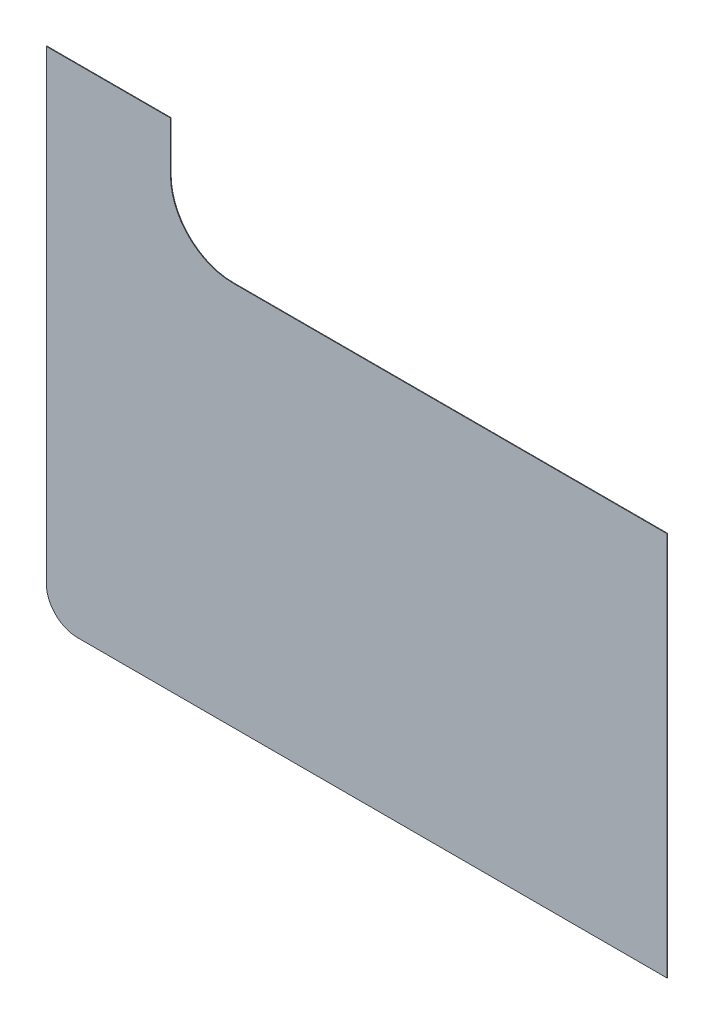
from build123d import *

# Parameters (mm, degrees)
EXTRUDE_1_DEPTH = 0.1
FILLET_1_R      = 10
FILLET_2_R      = 5


with BuildPart() as part:
    # 草图1 → 凸台-拉伸1 (new body)
    with BuildSketch(Plane.XY):
        Polygon((0, 0), (-100, 0), (-100, 80), (-80, 80), (-80, 62), (0, 62), align=None)
    extrude(amount=EXTRUDE_1_DEPTH)

    # 圆角1
    fillet_1_edges = [part.edges().sort_by_distance(p)[0] for p in [
        (-80, 62, 0.05),
    ]]
    fillet(fillet_1_edges, radius=FILLET_1_R)

    # 圆角2
    fillet_2_edges = [part.edges().sort_by_distance(p)[0] for p in [
        (-100, 0, 0.05),
    ]]
    fillet(fillet_2_edges, radius=FILLET_2_R)


solid = part.part
